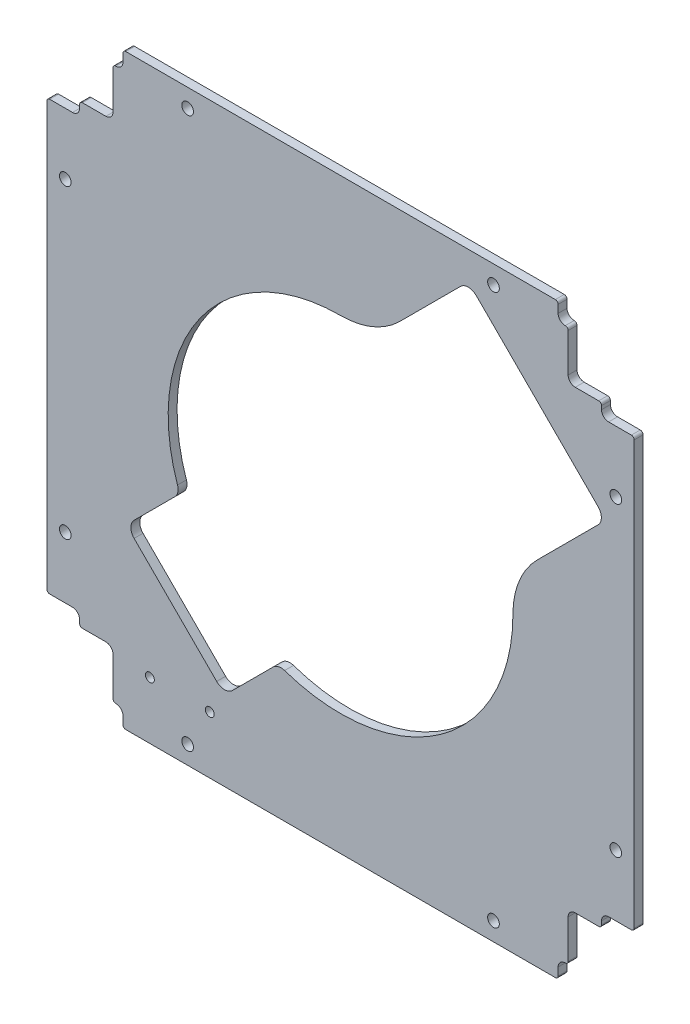
from build123d import *

# Parameters (mm, degrees)
SKETCH1_W                    = 106
SKETCH1_H                    = 106
MAINOUTLINE_DEPTH            = 1.6
SKETCH4_W                    = 11.7
SKETCH4_H                    = 11.7
RAILCUTOUTS_DEPTH            = 75.970394157
SKETCH13_W                   = 5.7
SKETCH13_H                   = 2.4
SKETCH13_W_2                 = 1.8
SKETCH13_H_2                 = 3
FILLETCUTOUTS_DEPTH          = 75.970394157
SMOOTHCORNER_DEPTH           = 10
MIRROR2_COPY_1_SKETCH_W      = 11.7
MIRROR2_COPY_1_SKETCH_H      = 11.7
MIRROR2_COPY_1_DEPTH         = 75.970394157
MIRROR2_COPY_2_SKETCH_W      = 5.7
MIRROR2_COPY_2_SKETCH_H      = 2.4
MIRROR2_COPY_2_SKETCH_W_2    = 1.8
MIRROR2_COPY_2_SKETCH_H_2    = 3
MIRROR2_COPY_2_DEPTH         = 75.970394157
MIRROR2_COPY_3_DEPTH         = 10
MIRROR2_COPY_4_SKETCH_W      = 11.7
MIRROR2_COPY_4_SKETCH_H      = 11.7
MIRROR2_COPY_4_DEPTH         = 75.970394157
MIRROR2_COPY_5_SKETCH_W      = 5.7
MIRROR2_COPY_5_SKETCH_H      = 2.4
MIRROR2_COPY_5_SKETCH_W_2    = 1.8
MIRROR2_COPY_5_SKETCH_H_2    = 3
MIRROR2_COPY_5_DEPTH         = 75.970394157
MIRROR2_COPY_6_DEPTH         = 10
FILLET10_R                   = 0.5
M2_CLEARANCE_HOLE1_D         = 2.1
SKETCH15_W                   = 90
SKETCH15_H                   = 5.2
SKETCH15_W_2                 = 5.2
SKETCH15_H_2                 = 90
CUT_EXTRUDE5_DEPTH           = 0.001
CUT_EXTRUDE2_DEPTH           = 75.970394157
CUT_EXTRUDE2_DEPTH_BACK      = 75.970394157
SKETCH11_R                   = 31
CUT_EXTRUDE7_DEPTH           = 10
FILLET11_R                   = 2
FILLET13_R                   = 15
SKETCH29_R                   = 0.8
CONNECTOR_LOCATION_DEPTH     = 10
CUT_EXTRUDE_THIN1_DEPTH      = 75.970394157
CUT_EXTRUDE_THIN1_DEPTH_BACK = 75.970394157
SKETCH31_W                   = 125.6
SKETCH31_H                   = 125.6
SKETCH31_W_2                 = 105.6
SKETCH31_H_2                 = 105.6
FILLET12_R                   = 0.5


with BuildPart() as part:
    # Sketch1 → mainOutline (new body)
    with BuildSketch(Plane.XY):
        Rectangle(SKETCH1_W, SKETCH1_H)
    extrude(amount=MAINOUTLINE_DEPTH)

    # Sketch4 → railCutouts (cut, through all)
    with BuildSketch(Plane(origin=(0, 0, 0), x_dir=(-1, 0, 0), z_dir=(0, 0, -1))):
        with Locations((47.15, 47.15)):
            Rectangle(SKETCH4_W, SKETCH4_H)
    railcutouts = extrude(amount=-RAILCUTOUTS_DEPTH, mode=Mode.SUBTRACT)

    # Sketch13 → filletCutouts (cut, symmetric)
    with BuildSketch(Plane(origin=(0, 0, 0), x_dir=(-1, 0, 0), z_dir=(0, 0, -1))):
        with Locations((50.15, 40.1)):
            Rectangle(SKETCH13_W, SKETCH13_H)
        with Locations((40.4, 51.5)):
            Rectangle(SKETCH13_W_2, SKETCH13_H_2)
    filletcutouts = extrude(amount=FILLETCUTOUTS_DEPTH, both=True, mode=Mode.SUBTRACT)

    # Sketch27 → smoothCorner (cut)
    with BuildSketch(Plane.XY.offset(1.6)):
        with BuildLine():
            Line((-40.928025612, 42.198025612), (-40.928025612, 49.628025612))
            Line((-40.928025612, 49.628025612), (-40.398025612, 49.628025612))
            ThreePointArc((-40.398025612, 49.628025612), (-39.5, 50), (-39.128025612, 50.898025612))
            Line((-39.128025612, 50.898025612), (-39.128025612, 53))
            Line((-39.128025612, 53), (-53, 53))
            Line((-53, 53), (-53, 38.528025612))
            Line((-53, 38.528025612), (-48.198025612, 38.528025612))
            ThreePointArc((-48.198025612, 38.528025612), (-47.3, 38.9), (-46.928025612, 39.798025612))
            Line((-46.928025612, 39.798025612), (-46.928025612, 40.928025612))
            Line((-46.928025612, 40.928025612), (-42.198025612, 40.928025612))
            ThreePointArc((-42.198025612, 40.928025612), (-41.3, 41.3), (-40.928025612, 42.198025612))
        make_face()
    smoothcorner = extrude(amount=-SMOOTHCORNER_DEPTH, mode=Mode.SUBTRACT)

    # Mirror1: railCutouts, filletCutouts, smoothCorner across plane
    add(railcutouts.mirror(Plane(origin=(0, 0, 0), x_dir=(0, 0, 1), z_dir=(1, 0, 0))), mode=Mode.SUBTRACT)
    add(filletcutouts.mirror(Plane(origin=(0, 0, 0), x_dir=(0, 0, 1), z_dir=(1, 0, 0))), mode=Mode.SUBTRACT)
    add(smoothcorner.mirror(Plane(origin=(0, 0, 0), x_dir=(0, 0, 1), z_dir=(1, 0, 0))), mode=Mode.SUBTRACT)

    # Mirror2 copy 1 sketch → Mirror2 copy 1 (cut, through all)
    with BuildSketch(Plane(origin=(0, 0, 0), x_dir=(1, 0, 0), z_dir=(0, 0, -1))):
        with Locations((47.15, 47.15)):
            Rectangle(MIRROR2_COPY_1_SKETCH_W, MIRROR2_COPY_1_SKETCH_H)
    extrude(amount=-MIRROR2_COPY_1_DEPTH, mode=Mode.SUBTRACT)

    # Mirror2 copy 2 sketch → Mirror2 copy 2 (cut, symmetric)
    with BuildSketch(Plane(origin=(0, 0, 0), x_dir=(1, 0, 0), z_dir=(0, 0, -1))):
        with Locations((50.15, 40.1)):
            Rectangle(MIRROR2_COPY_2_SKETCH_W, MIRROR2_COPY_2_SKETCH_H)
        with Locations((40.4, 51.5)):
            Rectangle(MIRROR2_COPY_2_SKETCH_W_2, MIRROR2_COPY_2_SKETCH_H_2)
    extrude(amount=MIRROR2_COPY_2_DEPTH, both=True, mode=Mode.SUBTRACT)

    # Mirror2 copy 3 sketch → Mirror2 copy 3 (cut)
    with BuildSketch(Plane(origin=(0, 0, 1.6), x_dir=(-1, 0, 0), z_dir=(0, 0, 1))):
        with BuildLine():
            Line((-40.928025612, 42.198025612), (-40.928025612, 49.628025612))
            Line((-40.928025612, 49.628025612), (-40.398025612, 49.628025612))
            ThreePointArc((-40.398025612, 49.628025612), (-39.5, 50), (-39.128025612, 50.898025612))
            Line((-39.128025612, 50.898025612), (-39.128025612, 53))
            Line((-39.128025612, 53), (-53, 53))
            Line((-53, 53), (-53, 38.528025612))
            Line((-53, 38.528025612), (-48.198025612, 38.528025612))
            ThreePointArc((-48.198025612, 38.528025612), (-47.3, 38.9), (-46.928025612, 39.798025612))
            Line((-46.928025612, 39.798025612), (-46.928025612, 40.928025612))
            Line((-46.928025612, 40.928025612), (-42.198025612, 40.928025612))
            ThreePointArc((-42.198025612, 40.928025612), (-41.3, 41.3), (-40.928025612, 42.198025612))
        make_face()
    extrude(amount=-MIRROR2_COPY_3_DEPTH, mode=Mode.SUBTRACT)

    # Mirror2 copy 4 sketch → Mirror2 copy 4 (cut, through all)
    with BuildSketch(Plane(origin=(0, 0, 0), x_dir=(-1, 0, 0), z_dir=(0, 0, -1))):
        with Locations((47.15, -47.15)):
            Rectangle(MIRROR2_COPY_4_SKETCH_W, MIRROR2_COPY_4_SKETCH_H)
    extrude(amount=-MIRROR2_COPY_4_DEPTH, mode=Mode.SUBTRACT)

    # Mirror2 copy 5 sketch → Mirror2 copy 5 (cut, symmetric)
    with BuildSketch(Plane(origin=(0, 0, 0), x_dir=(-1, 0, 0), z_dir=(0, 0, -1))):
        with Locations((50.15, -40.1)):
            Rectangle(MIRROR2_COPY_5_SKETCH_W, MIRROR2_COPY_5_SKETCH_H)
        with Locations((40.4, -51.5)):
            Rectangle(MIRROR2_COPY_5_SKETCH_W_2, MIRROR2_COPY_5_SKETCH_H_2)
    extrude(amount=MIRROR2_COPY_5_DEPTH, both=True, mode=Mode.SUBTRACT)

    # Mirror2 copy 6 sketch → Mirror2 copy 6 (cut)
    with BuildSketch(Plane.XY.offset(1.6)):
        with BuildLine():
            Line((-40.928025612, -42.198025612), (-40.928025612, -49.628025612))
            Line((-40.928025612, -49.628025612), (-40.398025612, -49.628025612))
            ThreePointArc((-40.398025612, -49.628025612), (-39.5, -50), (-39.128025612, -50.898025612))
            Line((-39.128025612, -50.898025612), (-39.128025612, -53))
            Line((-39.128025612, -53), (-53, -53))
            Line((-53, -53), (-53, -38.528025612))
            Line((-53, -38.528025612), (-48.198025612, -38.528025612))
            ThreePointArc((-48.198025612, -38.528025612), (-47.3, -38.9), (-46.928025612, -39.798025612))
            Line((-46.928025612, -39.798025612), (-46.928025612, -40.928025612))
            Line((-46.928025612, -40.928025612), (-42.198025612, -40.928025612))
            ThreePointArc((-42.198025612, -40.928025612), (-41.3, -41.3), (-40.928025612, -42.198025612))
        make_face()
    extrude(amount=-MIRROR2_COPY_6_DEPTH, mode=Mode.SUBTRACT)

    # Fillet10
    fillet10_edges = [part.edges().sort_by_distance(p)[0] for p in [
        (46.928025612, -40.928025612, 0.8),
        (40.928025612, -49.628025612, 0.8),
        (40.928025612, 49.628025612, 0.8),
        (46.928025612, 40.928025612, 0.8),
        (-46.928025612, 40.928025612, 0.8),
        (-40.928025612, 49.628025612, 0.8),
        (-46.928025612, -40.928025612, 0.8),
        (-40.928025612, -49.628025612, 0.8),
    ]]
    fillet(fillet10_edges, radius=FILLET10_R)

    # M2 Clearance Hole1 (through all)
    with Locations(Plane(origin=(0, 0, 0), x_dir=(-1, 0, 0), z_dir=(0, 0, -1))):
        with Locations((49.5, -27.5), (27.5, -49.5), (-49.5, -27.5), (-27.5, -49.5), (-27.5, 49.5), (-49.5, 27.5), (27.5, 49.5), (49.5, 27.5)):
            Hole(M2_CLEARANCE_HOLE1_D / 2)

    # Sketch15 → Cut-Extrude5 (cut)
    with BuildSketch(Plane(origin=(0, 0, 0), x_dir=(-1, 0, 0), z_dir=(0, 0, -1))):
        with Locations((0, 50.4)):
            Rectangle(SKETCH15_W, SKETCH15_H)
        with Locations((0, -50.4)):
            Rectangle(SKETCH15_W, SKETCH15_H)
        with Locations((-50.4, 0)):
            Rectangle(SKETCH15_W_2, SKETCH15_H_2)
        with Locations((50.4, 0)):
            Rectangle(SKETCH15_W_2, SKETCH15_H_2)
    extrude(amount=-CUT_EXTRUDE5_DEPTH, mode=Mode.SUBTRACT)

    # Sketch11 → Cut-Extrude2 (cut, two sides: drawn at the far end of the back side and taken through both)
    with BuildSketch(Plane(origin=(0, 0, 0), x_dir=(-1, 0, 0), z_dir=(0, 0, -1)).offset(-CUT_EXTRUDE2_DEPTH_BACK)):
        Circle(SKETCH11_R)
    extrude(amount=CUT_EXTRUDE2_DEPTH + CUT_EXTRUDE2_DEPTH_BACK, mode=Mode.SUBTRACT)

    # Sketch28 → Cut-Extrude7 (cut)
    with BuildSketch(Plane(origin=(0, 0, 0), x_dir=(-1, 0, 0), z_dir=(0, 0, -1))):
        Polygon((8.838834765, 8.838834765), (12.374368671, 12.374368671), (-22.980970389, 47.72970773), (-47.72970773, 22.980970389), (-12.374368671, -12.374368671), (-8.838834765, -8.838834765), (20.859650045, -38.537319575), (38.537319575, -20.859650045), align=None)
    extrude(amount=-CUT_EXTRUDE7_DEPTH, mode=Mode.SUBTRACT)

    # Fillet11
    fillet11_edges = [part.edges().sort_by_distance(p)[0] for p in [
        (47.72970773, 22.980970389, 0.8),
        (22.980970389, 47.72970773, 0.8),
        (-20.859650045, -38.537319575, 0.8),
        (-38.537319575, -20.859650045, 0.8),
        (-11.220452361, -28.898121891, 0.8),
        (-28.898121891, -11.220452361, 0.8),
    ]]
    fillet(fillet11_edges, radius=FILLET11_R)

    # Fillet13
    fillet13_edges = [part.edges().sort_by_distance(p)[0] for p in [
        (30.467875793, 5.719138452, 0.8),
        (5.719138452, 30.467875793, 0.8),
    ]]
    fillet(fillet13_edges, radius=FILLET13_R)

    # Sketch29 → Connector Location (cut)
    with BuildSketch(Plane(origin=(0, 0, 0), x_dir=(-1, 0, 0), z_dir=(0, 0, -1))):
        with Locations((34.285, -42.5)):
            Circle(SKETCH29_R)
        with Locations((23.515, -42.5)):
            Circle(SKETCH29_R)
    extrude(amount=-CONNECTOR_LOCATION_DEPTH, mode=Mode.SUBTRACT)

    # Sketch31 → Cut-Extrude-Thin1 (cut, two sides: drawn at the far end of the back side and taken through both)
    with BuildSketch(Plane(origin=(0, 0, 0), x_dir=(-1, 0, 0), z_dir=(0, 0, -1)).offset(-CUT_EXTRUDE_THIN1_DEPTH_BACK)):
        Rectangle(SKETCH31_W, SKETCH31_H)
        Rectangle(SKETCH31_W_2, SKETCH31_H_2, mode=Mode.SUBTRACT)
    extrude(amount=CUT_EXTRUDE_THIN1_DEPTH + CUT_EXTRUDE_THIN1_DEPTH_BACK, mode=Mode.SUBTRACT)

    # Fillet12
    fillet12_edges = [part.edges().sort_by_distance(p)[0] for p in [
        (-52.8, 38.528025612, 0.8005),
        (-39.128025612, 52.8, 0.8005),
        (39.128025612, 52.8, 0.8005),
        (52.8, 38.528025612, 0.8005),
        (52.8, -38.528025612, 0.8005),
        (39.128025612, -52.8, 0.8005),
        (-39.128025612, -52.8, 0.8005),
        (-52.8, -38.528025612, 0.8005),
    ]]
    fillet(fillet12_edges, radius=FILLET12_R)


solid = part.part
